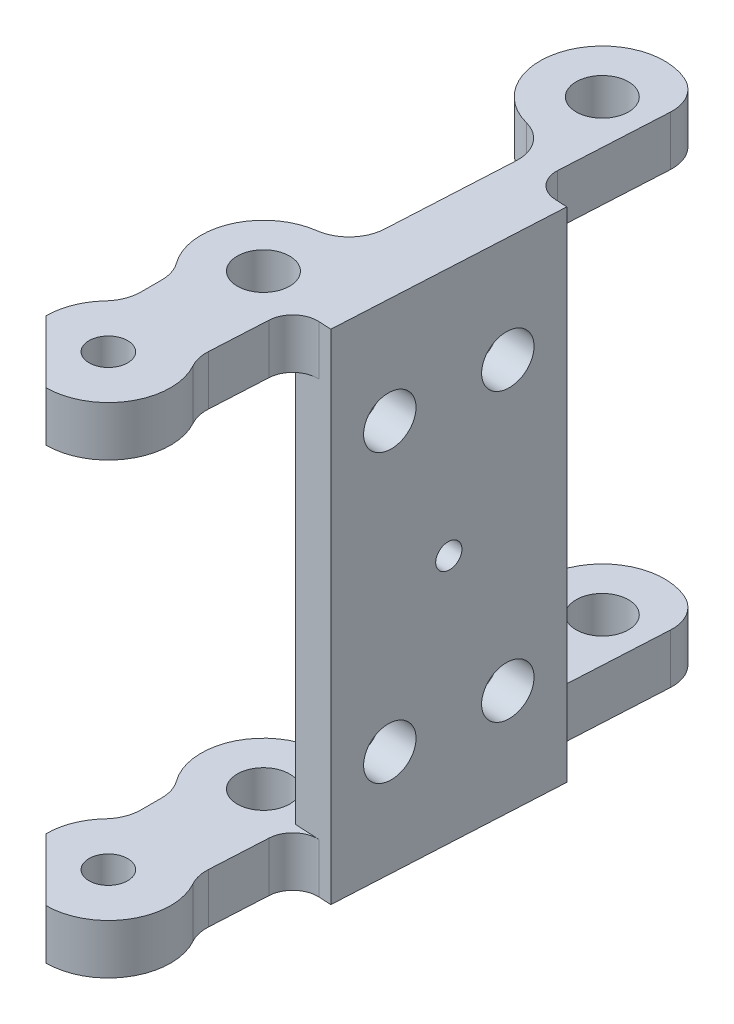
from build123d import *

# Parameters (mm, degrees)
SKETCH2_R           = 1.55
SKETCH2_R_2         = 2.1
BOSS_EXTRUDE3_DEPTH = 4
BOSS_EXTRUDE4_DEPTH = 40
FILLET1_R           = 2
SKETCH4_R           = 2
SKETCH4_R_2         = 1
CUT_EXTRUDE1_DEPTH  = 10
FILLET3_R           = 3
FILLET4_R           = 3


with BuildPart() as part:
    # Sketch2 → Boss-Extrude3 (new body)
    with BuildSketch(Plane(origin=(0, 0, 0), x_dir=(1, 0, 0), z_dir=(0, 1, 0))):
        with BuildLine():
            ThreePointArc((83.62627208, 73.409646321), (82.043328915, 71.619198109), (81.472187529, 69.298592288))
            Line((81.472187529, 69.298592288), (86.472187529, 64.298592288))
            ThreePointArc((86.472187529, 64.298592288), (90.961711336, 67.097643404), (90.424672494, 72.360921892))
            Line((90.424672494, 72.360921892), (90.926689774, 81.686644374))
            Line((90.926689774, 81.686644374), (92.048119667, 102.518883374))
            Line((92.048119667, 102.518883374), (92.450855554, 110.000305351))
            ThreePointArc((92.450855554, 110.000305351), (83.843337657, 108.444197301), (89.726552777, 101.971283238))
            Line((89.726552777, 101.971283238), (88.863578179, 85.80252536))
            ThreePointArc((88.863578179, 85.80252536), (82.866493913, 83.799788509), (83.62627208, 77.522949199))
            Line((83.62627208, 77.522949199), (83.62627208, 73.409646321))
        make_face()
        with Locations((86.472187529, 69.298592288)):
            Circle(SKETCH2_R, mode=Mode.SUBTRACT)
        with Locations((87.092070964, 81.126869023)):
            Circle(SKETCH2_R_2, mode=Mode.SUBTRACT)
        with Locations((88.578200606, 106.837625529)):
            Circle(SKETCH2_R_2, mode=Mode.SUBTRACT)
    boss_extrude3 = extrude(amount=BOSS_EXTRUDE3_DEPTH)

    # Sketch3 → Boss-Extrude4 (add)
    with BuildSketch(Plane(origin=(0, 4, 0), x_dir=(1, 0, 0), z_dir=(0, 1, 0))):
        Polygon((91.800965367, 97.92762227), (90.833399946, 79.953646162), (93.833399946, 79.792151774), (94.800965367, 97.766127883), align=None)
    extrude(amount=-BOSS_EXTRUDE4_DEPTH)

    # Mirror1: Boss-Extrude3 across plane
    add(boss_extrude3.mirror(Plane.ZX.offset(-16)))

    # Fillet1
    fillet1_edges = [part.edges().sort_by_distance(p)[0] for p in [
        (90.833399946, -34, -79.953646162),
        (90.833399946, 2, -79.953646162),
        (91.800965367, -34, -97.92762227),
        (91.800965367, 2, -97.92762227),
    ]]
    fillet(fillet1_edges, radius=FILLET1_R)

    # Sketch4 → Cut-Extrude1 (cut)
    with BuildSketch(Plane(origin=(86.279355648, 0, 4.6445439), x_dir=(-0.05375363451621944, 0, 0.9985542282601866), z_dir=(-0.9985542282601865, 0, -0.05375363451621943))):
        with Locations((-89.220676822, -4.5)):
            Circle(SKETCH4_R)
        with Locations((-98.220676822, -4.5)):
            Circle(SKETCH4_R)
        with Locations((-89.220676822, -27.5)):
            Circle(SKETCH4_R)
        with Locations((-98.220676822, -27.5)):
            Circle(SKETCH4_R)
        with Locations((-93.720676822, -16)):
            Circle(SKETCH4_R_2)
    extrude(amount=-CUT_EXTRUDE1_DEPTH, mode=Mode.SUBTRACT)

    # Fillet3
    fillet3_edges = [part.edges().sort_by_distance(p)[0] for p in [
        (92.450855554, -34, -110.000305351),
        (92.450855554, 2, -110.000305351),
        (90.424672494, -34, -72.360921892),
        (90.424672494, 2, -72.360921892),
        (89.726552777, -34, -101.971283238),
        (89.726552777, 2, -101.971283238),
        (83.62627208, 2, -73.409646321),
        (83.62627208, 2, -77.522949199),
        (83.62627208, -34, -73.409646321),
        (83.62627208, -34, -77.522949199),
    ]]
    fillet(fillet3_edges, radius=FILLET3_R)

    # Fillet4
    fillet4_edges = [part.edges().sort_by_distance(p)[0] for p in [
        (88.863578179, -34, -85.80252536),
        (88.863578179, 2, -85.80252536),
    ]]
    fillet(fillet4_edges, radius=FILLET4_R)


solid = part.part
